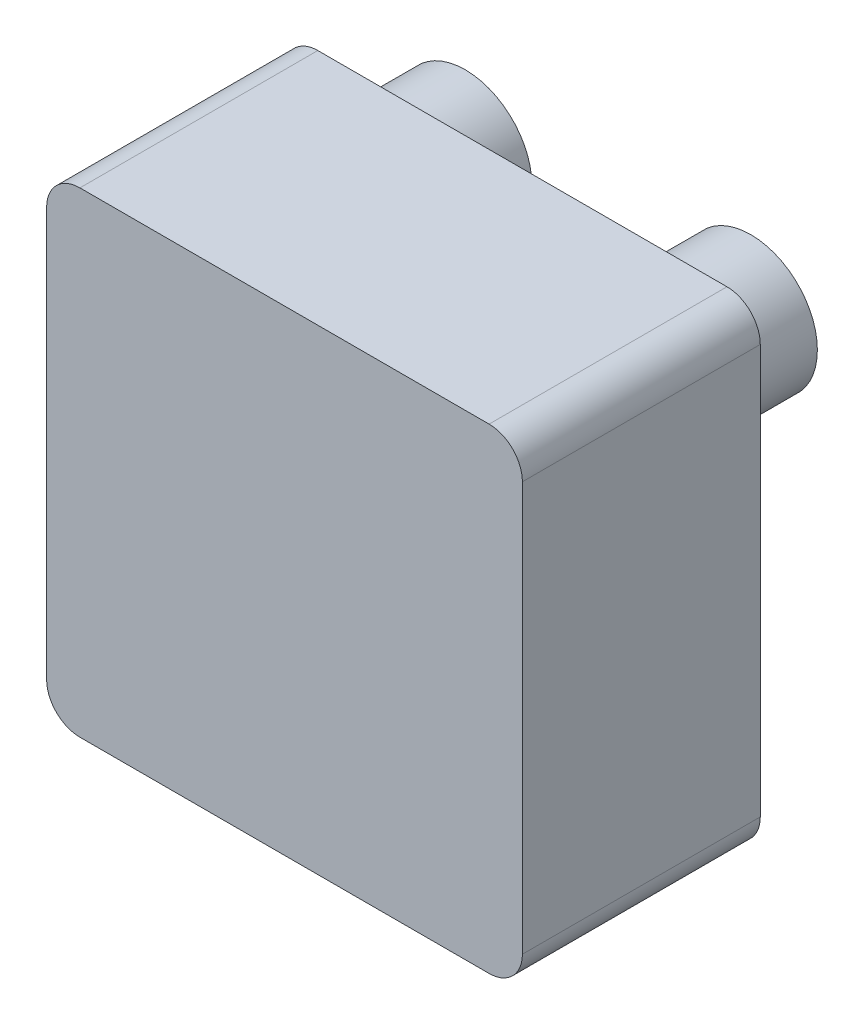
from build123d import *

# Parameters (mm, degrees)
SKETCH2_W           = 10
SKETCH2_H           = 5
BOSS_EXTRUDE2_DEPTH = 10
SKETCH3_R           = 1.4
BOSS_EXTRUDE3_DEPTH = 1.8
SKETCH4_W           = 1.85
SKETCH4_H           = 0.35
CUT_EXTRUDE1_DEPTH  = 5
SKETCH5_R           = 1.2
CUT_EXTRUDE2_DEPTH  = 3.5
FILLET1_R           = 0.7


with BuildPart() as part:
    # Sketch2 → Boss-Extrude2 (new body)
    with BuildSketch(Plane(origin=(0, 0, 0), x_dir=(1, 0, 0), z_dir=(0, 1, 0))):
        with Locations((5, 2.5)):
            Rectangle(SKETCH2_W, SKETCH2_H)
    extrude(amount=BOSS_EXTRUDE2_DEPTH)

    # Sketch3 → Boss-Extrude3 (add)
    with BuildSketch(Plane(origin=(0, 0, -5), x_dir=(-1, 0, 0), z_dir=(0, 0, -1))):
        with Locations((-8, 8)):
            Circle(SKETCH3_R)
        with Locations((-2, 8)):
            Circle(SKETCH3_R)
    extrude(amount=BOSS_EXTRUDE3_DEPTH)

    # Sketch4 → Cut-Extrude1 (cut)
    with BuildSketch(Plane.XZ):
        with Locations((3.425, -4.825)):
            Rectangle(SKETCH4_W, SKETCH4_H)
        with Locations((6.575, -4.825)):
            Rectangle(SKETCH4_W, SKETCH4_H)
    extrude(amount=-CUT_EXTRUDE1_DEPTH, mode=Mode.SUBTRACT)

    # Sketch5 → Cut-Extrude2 (cut)
    with BuildSketch(Plane.XZ):
        with Locations((5, -2.5)):
            Circle(SKETCH5_R)
    extrude(amount=-CUT_EXTRUDE2_DEPTH, mode=Mode.SUBTRACT)

    # Fillet1
    fillet1_edges = [part.edges().sort_by_distance(p)[0] for p in [
        (10, 0, -2.5),
        (0, 0, -2.5),
        (0, 10, -2.5),
        (10, 10, -2.5),
    ]]
    fillet(fillet1_edges, radius=FILLET1_R)


solid = part.part
